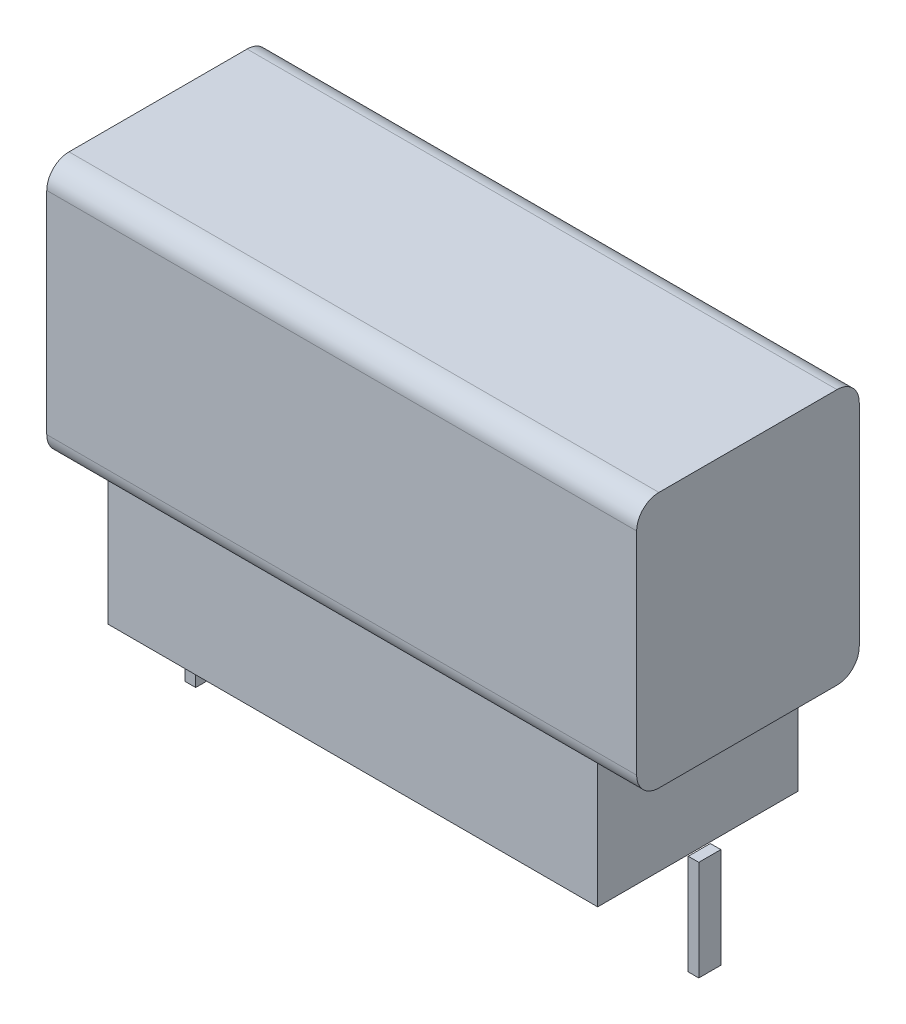
from build123d import *

# Parameters (mm, degrees)
SKETCH_1_W        = 22
SKETCH_1_H        = 9
EXTRUDE_1_DEPTH   = 5.5
SKETCH_2_W        = 26.5
SKETCH_2_H        = 10
EXTRUDE_2_DEPTH   = 11.5
SKETCH_3_W        = 0.473160644
SKETCH_3_H        = 0.99156312
EXTRUDE_3_DEPTH   = 4.5
EXTRUDE_3_2_DEPTH = 4.5
FILLET_1_R        = 1


with BuildPart() as part:
    # 草图1 → 凸台-拉伸1 (new body)
    with BuildSketch(Plane(origin=(0, 0, 0), x_dir=(1, 0, 0), z_dir=(0, 1, 0))):
        Rectangle(SKETCH_1_W, SKETCH_1_H)
    extrude(amount=EXTRUDE_1_DEPTH)

    # 草图2 → 凸台-拉伸2 (add)
    with BuildSketch(Plane(origin=(0, 5.5, 0), x_dir=(1, 0, 0), z_dir=(0, 1, 0))):
        Rectangle(SKETCH_2_W, SKETCH_2_H)
    extrude(amount=EXTRUDE_2_DEPTH)

    # 圆角1
    # the kernel refuses this fillet: 1 mm, written as the material it takes off along each edge
    with BuildSketch(Plane(origin=(15.75, 5.5, 5), x_dir=(0, 0, -1), z_dir=(-1, 0, 0))) as fillet_1_piece_1_section:
        with BuildLine():
            CenterArc((FILLET_1_R, -FILLET_1_R), FILLET_1_R, 90, 90)
            Line((0, -FILLET_1_R), (0, 0))
            Line((0, 0), (FILLET_1_R, 0))
        make_face()
    fillet_1_piece_1 = extrude(amount=31.5, mode=Mode.PRIVATE)
    fillet_1_piece_1 = split(fillet_1_piece_1, bisect_by=Plane(origin=(11, 5.524008382, 4.336749215), z_dir=(1, 0, 0)), keep=Keep.TOP, mode=Mode.PRIVATE)
    fillet_1_piece_1 = split(fillet_1_piece_1, bisect_by=Plane(origin=(13.375, 5.524008382, 4.5), z_dir=(0, 0, -1)), keep=Keep.TOP, mode=Mode.PRIVATE)
    add(fillet_1_piece_1, mode=Mode.SUBTRACT)
    with BuildSketch(Plane(origin=(15.75, 5.5, 5), x_dir=(0, 0, -1), z_dir=(-1, 0, 0))) as fillet_1_piece_2_section:
        with BuildLine():
            CenterArc((FILLET_1_R, -FILLET_1_R), FILLET_1_R, 90, 90)
            Line((0, -FILLET_1_R), (0, 0))
            Line((0, 0), (FILLET_1_R, 0))
        make_face()
    fillet_1_piece_2 = extrude(amount=31.5, mode=Mode.PRIVATE)
    fillet_1_piece_2 = split(fillet_1_piece_2, bisect_by=Plane(origin=(11, 5.75512006, 4.835608236), z_dir=(1, 0, 0)), keep=Keep.TOP, mode=Mode.PRIVATE)
    fillet_1_piece_2 = split(fillet_1_piece_2, bisect_by=Plane(origin=(13.375, 5.75512006, 4.5), z_dir=(0, 0, 1)), keep=Keep.TOP, mode=Mode.PRIVATE)
    add(fillet_1_piece_2, mode=Mode.SUBTRACT)
    with BuildSketch(Plane(origin=(15.75, 5.5, 5), x_dir=(0, 0, -1), z_dir=(-1, 0, 0))) as fillet_1_piece_3_section:
        with BuildLine():
            CenterArc((FILLET_1_R, -FILLET_1_R), FILLET_1_R, 90, 90)
            Line((0, -FILLET_1_R), (0, 0))
            Line((0, 0), (FILLET_1_R, 0))
        make_face()
    fillet_1_piece_3 = extrude(amount=31.5, mode=Mode.PRIVATE)
    fillet_1_piece_3 = split(fillet_1_piece_3, bisect_by=Plane(origin=(11, 5.75512006, 4.835608236), z_dir=(-1, 0, 0)), keep=Keep.TOP, mode=Mode.PRIVATE)
    fillet_1_piece_3 = split(fillet_1_piece_3, bisect_by=Plane(origin=(0, 5.75512006, 4.5), z_dir=(0, 0, 1)), keep=Keep.TOP, mode=Mode.PRIVATE)
    fillet_1_piece_3 = split(fillet_1_piece_3, bisect_by=Plane(origin=(-11, 5.75512006, 4.835608236), z_dir=(1, 0, 0)), keep=Keep.TOP, mode=Mode.PRIVATE)
    add(fillet_1_piece_3, mode=Mode.SUBTRACT)
    with BuildSketch(Plane(origin=(15.75, 5.5, 5), x_dir=(0, 0, -1), z_dir=(-1, 0, 0))) as fillet_1_piece_4_section:
        with BuildLine():
            CenterArc((FILLET_1_R, -FILLET_1_R), FILLET_1_R, 90, 90)
            Line((0, -FILLET_1_R), (0, 0))
            Line((0, 0), (FILLET_1_R, 0))
        make_face()
    fillet_1_piece_4 = extrude(amount=31.5, mode=Mode.PRIVATE)
    fillet_1_piece_4 = split(fillet_1_piece_4, bisect_by=Plane(origin=(-13.375, 5.524008382, 4.5), z_dir=(0, 0, -1)), keep=Keep.TOP, mode=Mode.PRIVATE)
    fillet_1_piece_4 = split(fillet_1_piece_4, bisect_by=Plane(origin=(-11, 5.524008382, 4.336749215), z_dir=(-1, 0, 0)), keep=Keep.TOP, mode=Mode.PRIVATE)
    add(fillet_1_piece_4, mode=Mode.SUBTRACT)
    with BuildSketch(Plane(origin=(15.75, 5.5, 5), x_dir=(0, 0, -1), z_dir=(-1, 0, 0))) as fillet_1_piece_5_section:
        with BuildLine():
            CenterArc((FILLET_1_R, -FILLET_1_R), FILLET_1_R, 90, 90)
            Line((0, -FILLET_1_R), (0, 0))
            Line((0, 0), (FILLET_1_R, 0))
        make_face()
    fillet_1_piece_5 = extrude(amount=31.5, mode=Mode.PRIVATE)
    fillet_1_piece_5 = split(fillet_1_piece_5, bisect_by=Plane(origin=(-13.375, 5.75512006, 4.5), z_dir=(0, 0, 1)), keep=Keep.TOP, mode=Mode.PRIVATE)
    fillet_1_piece_5 = split(fillet_1_piece_5, bisect_by=Plane(origin=(-11, 5.75512006, 4.835608236), z_dir=(-1, 0, 0)), keep=Keep.TOP, mode=Mode.PRIVATE)
    add(fillet_1_piece_5, mode=Mode.SUBTRACT)
    with BuildSketch(Plane(origin=(-15.75, 5.5, -5), x_dir=(0, 1, 0), z_dir=(1, 0, 0))) as fillet_1_piece_6_section:
        with BuildLine():
            CenterArc((FILLET_1_R, FILLET_1_R), FILLET_1_R, 180, 90)
            Line((0, FILLET_1_R), (0, 0))
            Line((0, 0), (FILLET_1_R, 0))
        make_face()
    fillet_1_piece_6 = extrude(amount=31.5, mode=Mode.PRIVATE)
    fillet_1_piece_6 = split(fillet_1_piece_6, bisect_by=Plane(origin=(-13.375, 5.75512006, -4.5), z_dir=(0, 0, -1)), keep=Keep.TOP, mode=Mode.PRIVATE)
    fillet_1_piece_6 = split(fillet_1_piece_6, bisect_by=Plane(origin=(-11, 5.75512006, -4.835608236), z_dir=(-1, 0, 0)), keep=Keep.TOP, mode=Mode.PRIVATE)
    add(fillet_1_piece_6, mode=Mode.SUBTRACT)
    with BuildSketch(Plane(origin=(-15.75, 5.5, -5), x_dir=(0, 1, 0), z_dir=(1, 0, 0))) as fillet_1_piece_7_section:
        with BuildLine():
            CenterArc((FILLET_1_R, FILLET_1_R), FILLET_1_R, 180, 90)
            Line((0, FILLET_1_R), (0, 0))
            Line((0, 0), (FILLET_1_R, 0))
        make_face()
    fillet_1_piece_7 = extrude(amount=31.5, mode=Mode.PRIVATE)
    fillet_1_piece_7 = split(fillet_1_piece_7, bisect_by=Plane(origin=(-13.375, 5.524008382, -4.5), z_dir=(0, 0, 1)), keep=Keep.TOP, mode=Mode.PRIVATE)
    fillet_1_piece_7 = split(fillet_1_piece_7, bisect_by=Plane(origin=(-11, 5.524008382, -4.336749215), z_dir=(-1, 0, 0)), keep=Keep.TOP, mode=Mode.PRIVATE)
    add(fillet_1_piece_7, mode=Mode.SUBTRACT)
    with BuildSketch(Plane(origin=(-15.75, 5.5, -5), x_dir=(0, 1, 0), z_dir=(1, 0, 0))) as fillet_1_piece_8_section:
        with BuildLine():
            CenterArc((FILLET_1_R, FILLET_1_R), FILLET_1_R, 180, 90)
            Line((0, FILLET_1_R), (0, 0))
            Line((0, 0), (FILLET_1_R, 0))
        make_face()
    fillet_1_piece_8 = extrude(amount=31.5, mode=Mode.PRIVATE)
    fillet_1_piece_8 = split(fillet_1_piece_8, bisect_by=Plane(origin=(0, 5.75512006, -4.5), z_dir=(0, 0, -1)), keep=Keep.TOP, mode=Mode.PRIVATE)
    fillet_1_piece_8 = split(fillet_1_piece_8, bisect_by=Plane(origin=(11, 5.75512006, -4.835608236), z_dir=(-1, 0, 0)), keep=Keep.TOP, mode=Mode.PRIVATE)
    fillet_1_piece_8 = split(fillet_1_piece_8, bisect_by=Plane(origin=(-11, 5.75512006, -4.835608236), z_dir=(1, 0, 0)), keep=Keep.TOP, mode=Mode.PRIVATE)
    add(fillet_1_piece_8, mode=Mode.SUBTRACT)
    with BuildSketch(Plane(origin=(-15.75, 5.5, -5), x_dir=(0, 1, 0), z_dir=(1, 0, 0))) as fillet_1_piece_9_section:
        with BuildLine():
            CenterArc((FILLET_1_R, FILLET_1_R), FILLET_1_R, 180, 90)
            Line((0, FILLET_1_R), (0, 0))
            Line((0, 0), (FILLET_1_R, 0))
        make_face()
    fillet_1_piece_9 = extrude(amount=31.5, mode=Mode.PRIVATE)
    fillet_1_piece_9 = split(fillet_1_piece_9, bisect_by=Plane(origin=(13.375, 5.75512006, -4.5), z_dir=(0, 0, -1)), keep=Keep.TOP, mode=Mode.PRIVATE)
    fillet_1_piece_9 = split(fillet_1_piece_9, bisect_by=Plane(origin=(11, 5.75512006, -4.835608236), z_dir=(1, 0, 0)), keep=Keep.TOP, mode=Mode.PRIVATE)
    add(fillet_1_piece_9, mode=Mode.SUBTRACT)
    with BuildSketch(Plane(origin=(-15.75, 5.5, -5), x_dir=(0, 1, 0), z_dir=(1, 0, 0))) as fillet_1_piece_10_section:
        with BuildLine():
            CenterArc((FILLET_1_R, FILLET_1_R), FILLET_1_R, 180, 90)
            Line((0, FILLET_1_R), (0, 0))
            Line((0, 0), (FILLET_1_R, 0))
        make_face()
    fillet_1_piece_10 = extrude(amount=31.5, mode=Mode.PRIVATE)
    fillet_1_piece_10 = split(fillet_1_piece_10, bisect_by=Plane(origin=(13.375, 5.524008382, -4.5), z_dir=(0, 0, 1)), keep=Keep.TOP, mode=Mode.PRIVATE)
    fillet_1_piece_10 = split(fillet_1_piece_10, bisect_by=Plane(origin=(11, 5.524008382, -4.336749215), z_dir=(1, 0, 0)), keep=Keep.TOP, mode=Mode.PRIVATE)
    add(fillet_1_piece_10, mode=Mode.SUBTRACT)
    with BuildSketch(Plane(origin=(-15.75, 17, -5), x_dir=(0, -1, 0), z_dir=(1, 0, 0))) as fillet_1_piece_11:
        with BuildLine():
            CenterArc((FILLET_1_R, -FILLET_1_R), FILLET_1_R, 90, 90)
            Line((0, -FILLET_1_R), (0, 0))
            Line((0, 0), (FILLET_1_R, 0))
        make_face()
    extrude(amount=31.5, mode=Mode.SUBTRACT)
    with BuildSketch(Plane(origin=(15.75, 17, 5), x_dir=(0, 0, -1), z_dir=(-1, 0, 0))) as fillet_1_piece_12:
        with BuildLine():
            CenterArc((FILLET_1_R, FILLET_1_R), FILLET_1_R, 180, 90)
            Line((0, FILLET_1_R), (0, 0))
            Line((0, 0), (FILLET_1_R, 0))
        make_face()
    extrude(amount=31.5, mode=Mode.SUBTRACT)


with BuildPart() as body_2:
    # 草图3 → 凸台-拉伸3 (new body)
    with BuildSketch(Plane.XZ):
        with Locations((-11.3, 0)):
            Rectangle(SKETCH_3_W, SKETCH_3_H)
    extrude(amount=EXTRUDE_3_DEPTH)


with BuildPart() as body_3:
    # 草图3 → Extrude 3 2 (new body)
    with BuildSketch(Plane.XZ):
        with Locations((11.3, 0)):
            Rectangle(SKETCH_3_W, SKETCH_3_H)
    extrude(amount=EXTRUDE_3_2_DEPTH)


solid = Compound([part.part, body_2.part, body_3.part])
